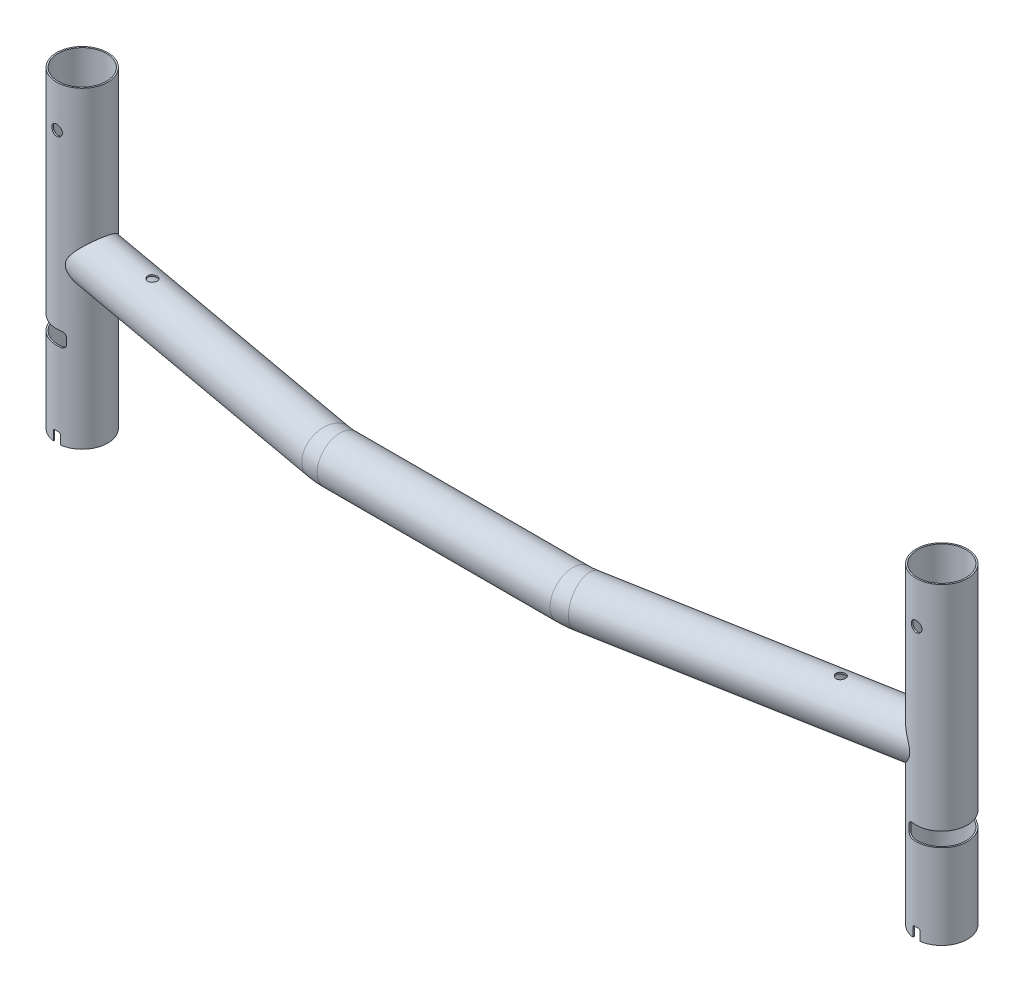
from build123d import *

# Parameters (mm, degrees)
SKETCH2_R               = 12.7
SKETCH2_R_2             = 11.899999999999999
BOSS_EXTRUDE1_START     = -88
SKETCH3_R               = 14.299999999999955
SKETCH3_R_2             = 13.500000000000002
BOSS_EXTRUDE1_DEPTH     = 174.5
SKETCH4_R               = 13.500000000000002
CUT_EXTRUDE1_DEPTH      = 312.6540844742015
SKETCH5_R               = 11.9
CUT_EXTRUDE2_DEPTH      = 88
CUT_EXTRUDE3_DEPTH      = 20
CUT_EXTRUDE5_REACH      = 274.804
CUT_EXTRUDE5_END_RADIUS = 13.5
CUT_EXTRUDE4_REACH      = 274.804
SKETCH8_R               = 2.9999999999999947
SKETCH10_R              = 2.9499999999999993
CUT_EXTRUDE6_DEPTH      = 273.8039925517087
CUT_EXTRUDE7_DEPTH      = 273.8039925517087
CUT_EXTRUDE7_DEPTH_BACK = 273.8039925517087
SKETCH11_R              = 2.599999999999989
SKETCH11_R_2            = 2.599999999999936


with BuildPart() as part:
    # Sweep1: sweep along a path in Sketch1
    with BuildLine(Plane(origin=(0, 0, 0), x_dir=(1, 0, 0), z_dir=(0, 1, 0))) as sweep1_path:
        Line((234, 30), (72.13858861003506, 0.6421475095924819))
        ThreePointArc((72.13858861003506, 0.6421475095924819), (68.58370620891968, 0.16086032796202687), (65, 0))
        Line((65, 0), (-65, 0))
        ThreePointArc((-65, 0), (-68.58370620891968, 0.16086032796202687), (-72.13858861003506, 0.6421475095924819))
        Line((-72.13858861003506, 0.6421475095924819), (-234, 30))
    # Sketch2 → Sweep1 (sweep)
    with BuildSketch(Plane(origin=(234.00000000000003, 0, -30.000000000000007), x_dir=(-0.1784647152508764, 0, -0.9839463122601881), z_dir=(0.9839463122601881, 0, -0.1784647152508764))):
        Circle(SKETCH2_R)
        Circle(SKETCH2_R_2, mode=Mode.SUBTRACT)
    sweep(path=sweep1_path.line)

    # Sketch3 → Boss-Extrude1 (add)
    with BuildSketch(Plane(origin=(0, 0, 0), x_dir=(1, 0, 0), z_dir=(0, 1, 0)).offset(BOSS_EXTRUDE1_START)):
        with Locations((239.9036778735612, 31.070788291505277)):
            Circle(SKETCH3_R)
        with Locations((239.9036778735612, 31.070788291505277)):
            Circle(SKETCH3_R_2, mode=Mode.SUBTRACT)
    boss_extrude1 = extrude(amount=BOSS_EXTRUDE1_DEPTH)

    # Sketch4 → Cut-Extrude1 (cut, through all)
    with BuildSketch(Plane.XZ.offset(88)):
        with Locations((239.9036778735612, -31.070788291505277)):
            Circle(SKETCH4_R)
    cut_extrude1 = extrude(amount=-CUT_EXTRUDE1_DEPTH, mode=Mode.SUBTRACT)

    # Sketch5 → Cut-Extrude2 (cut)
    with BuildSketch(Plane(origin=(234.00000000000003, 0, -30.000000000000007), x_dir=(-0.1784647152508764, 0, -0.9839463122601881), z_dir=(0.9839463122601881, 0, -0.1784647152508764))):
        with Locations((-0.01488844486755708, 0)):
            Circle(SKETCH5_R)
    cut_extrude2 = extrude(amount=-CUT_EXTRUDE2_DEPTH, mode=Mode.SUBTRACT)

    # Sketch7 → Cut-Extrude3 (cut, symmetric)
    with BuildSketch(Plane(origin=(239.90367787356124, 86.5, -31.07078829150528), x_dir=(-0.9413548600027752, 0, -0.33741817904368404), z_dir=(0.33741817904368404, 0, -0.9413548600027752))):
        with BuildLine():
            Line((-12.700000000000045, -119.23057124999997), (-27.494203982349365, -119.23057124999997))
            Line((-27.494203982349365, -119.23057124999997), (-27.49420398234936, -127.23057124999998))
            Line((-27.49420398234936, -127.23057124999998), (-12.700000000000045, -127.23057124999998))
            Line((-12.700000000000045, -127.23057124999998), (-2.499999999999999, -127.23057124999998))
            ThreePointArc((-2.499999999999999, -127.23057124999998), (-0.7322330470336309, -126.49833820296635), (5e-17, -124.73057124999998))
            Line((5e-17, -124.73057124999998), (-8.7e-16, -121.73057124999997))
            ThreePointArc((-8.7e-16, -121.73057124999997), (-0.732233047033632, -119.9628042970336), (-2.5000000000000004, -119.23057124999995))
            Line((-2.5000000000000004, -119.23057124999995), (-12.700000000000045, -119.23057124999997))
        make_face()
    cut_extrude3 = extrude(amount=CUT_EXTRUDE3_DEPTH, both=True, mode=Mode.SUBTRACT)

    # Cut-Extrude5: up to this cylinder (the profile starts outside it)
    cut_extrude5_end = Plane(origin=(239.9036778735612, -88.052119, -31.070788291505277), z_dir=(0, 1, 0)) * Cylinder(CUT_EXTRUDE5_END_RADIUS, 577.608, mode=Mode.PRIVATE)
    # Sketch9 → Cut-Extrude5 (cut, up to the surface)
    with BuildSketch(Plane.XY, mode=Mode.PRIVATE) as cut_extrude5_sk1:
        with BuildLine():
            Line((238.9036778735612, -82), (240.9036778735612, -82))
            ThreePointArc((240.9036778735612, -82), (241.61078465474776, -82.29289321881345), (241.9036778735612, -83))
            Line((241.9036778735612, -83), (241.9036778735612, -94))
            Line((241.9036778735612, -94), (237.9036778735612, -94))
            Line((237.9036778735612, -94), (237.9036778735612, -83))
            ThreePointArc((237.9036778735612, -83), (238.19657109237465, -82.29289321881345), (238.9036778735612, -82))
        make_face()
    cut_extrude5_tool1 = extrude(cut_extrude5_sk1.sketch, amount=-CUT_EXTRUDE5_REACH, mode=Mode.PRIVATE) - cut_extrude5_end
    cut_extrude5 = cut_extrude5_tool1.solids().sort_by_distance((239.903678, -88.052119, 0))[0]
    add(cut_extrude5, mode=Mode.SUBTRACT)

    # Mirror1: Boss-Extrude1, Cut-Extrude1, Cut-Extrude2, Cut-Extrude3, Cut-Extrude5 across plane
    add(boss_extrude1.mirror(Plane(origin=(0, 0, 0), x_dir=(0, 0, 1), z_dir=(1, 0, 0))))
    add(cut_extrude1.mirror(Plane(origin=(0, 0, 0), x_dir=(0, 0, 1), z_dir=(1, 0, 0))), mode=Mode.SUBTRACT)
    add(cut_extrude2.mirror(Plane(origin=(0, 0, 0), x_dir=(0, 0, 1), z_dir=(1, 0, 0))), mode=Mode.SUBTRACT)
    add(cut_extrude3.mirror(Plane(origin=(0, 0, 0), x_dir=(0, 0, 1), z_dir=(1, 0, 0))), mode=Mode.SUBTRACT)
    add(cut_extrude5.mirror(Plane(origin=(0, 0, 0), x_dir=(0, 0, 1), z_dir=(1, 0, 0))), mode=Mode.SUBTRACT)

    # Sketch8 → Cut-Extrude4 (cut, up to next)
    with BuildSketch(Plane(origin=(0, 0, 0), x_dir=(1, 0, 0), z_dir=(0, 1, 0)), mode=Mode.PRIVATE) as cut_extrude4_sk1:
        with Locations((216.9875163818188, 26.593661315401395)):
            Circle(SKETCH8_R)
    cut_extrude4_tool1 = extrude(cut_extrude4_sk1.sketch, amount=-CUT_EXTRUDE4_REACH, mode=Mode.PRIVATE) & part.part
    add(cut_extrude4_tool1.solids().sort_by_distance((216.987516, 0, -26.593661))[0], mode=Mode.SUBTRACT)

    # Sketch10 → Cut-Extrude6 (cut, symmetric)
    with BuildSketch(Plane.XY):
        with Locations((-239.9036778735612, 63.269428750000024)):
            Circle(SKETCH10_R)
    cut_extrude6 = extrude(amount=CUT_EXTRUDE6_DEPTH, both=True, mode=Mode.SUBTRACT)

    # Sketch11 → Cut-Extrude7 (cut, two sides: drawn at the far end of the back side and taken through both)
    with BuildSketch(Plane(origin=(0, 0, 0), x_dir=(1, 0, 0), z_dir=(0, 1, 0)).offset(-CUT_EXTRUDE7_DEPTH_BACK)):
        with Locations((192.08420105567154, 22.57589065136944)):
            Circle(SKETCH11_R)
        with Locations((-192.08420105567154, 22.57589065136944)):
            Circle(SKETCH11_R_2)
    extrude(amount=CUT_EXTRUDE7_DEPTH + CUT_EXTRUDE7_DEPTH_BACK, mode=Mode.SUBTRACT)

    # Mirror2: Cut-Extrude6 across plane
    add(cut_extrude6.mirror(Plane(origin=(0, 0, 0), x_dir=(0, 0, 1), z_dir=(1, 0, 0))), mode=Mode.SUBTRACT)


solid = part.part
